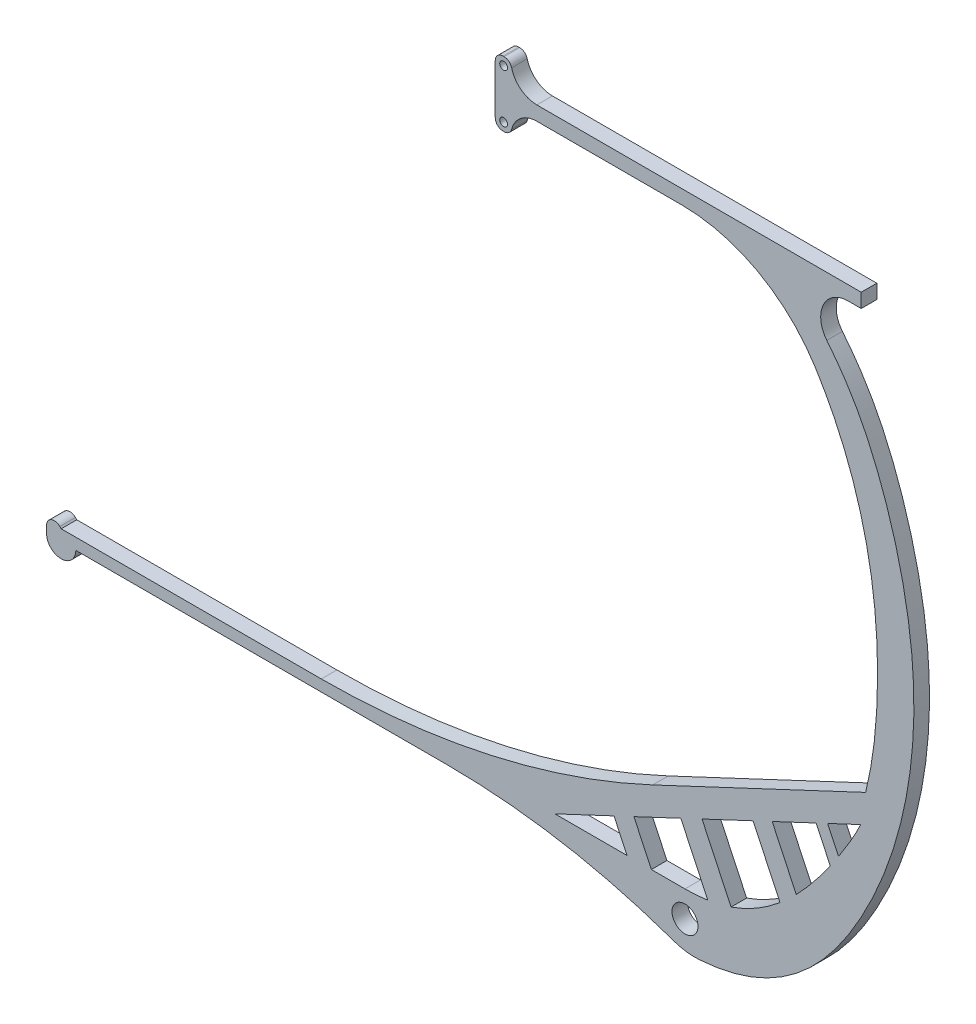
from build123d import *

# Parameters (mm, degrees)
BOSS_EXTRUDE1_DEPTH      = 3
BOSS_EXTRUDE1_DEPTH_BACK = 3
SKETCH1_R                = 5
FILLET1_START            = -3
FILLET1_DEPTH            = 6
SKETCH3_R                = 1.5
CUT_EXTRUDE1_DEPTH       = 349.413906295
FILLET2_R                = 3
BOSS_EXTRUDE2_DEPTH      = 6


with BuildPart() as part:
    # Sketch1 → Boss-Extrude1 (new, two sides: drawn at the far end of the back side and taken through both)
    with BuildSketch(Plane.XY.offset(-BOSS_EXTRUDE1_DEPTH_BACK)):
        with BuildLine():
            Line((-139.927663014, 10), (-240, 10))
            Line((-240, 10), (-240, 5.625896326))
            Line((-240, 5.625896326), (-91.67097898, 5.625896326))
            ThreePointArc((-91.67097898, 5.625896326), (-47.943457504, 1.922411841), (-5.461660623, -9.082535478))
            Line((-5.461660623, -9.082535478), (-4.403604208, -9.454396292))
            ThreePointArc((-4.403604208, -9.454396292), (0.528404036, -10.64278059), (5.598736393, -10.81216877))
            add(Edge.make_bspline(
                [(5.598736393, -10.81216877), (36.652992265, -8.693156062), (78.227632244, 36.40065328), (94.590344538, 116.465590815), (76.626831013, 184.736667386), (63.306328088, 209.262504208), (54.564036902, 220.049625577)],
                knots=[0.015792228, 0.015792228, 0.015792228, 0.015792228, 0.284946291, 0.62839983, 0.811916795, 0.93697406, 0.93697406, 0.93697406, 0.93697406], degree=3))
            ThreePointArc((54.564036902, 220.049625577), (53.234460191, 231.254741201), (62.776823889, 237.276840954))
            Line((62.776823889, 237.276840954), (67.80233028, 237.276840954))
            Line((67.80233028, 237.276840954), (67.80233028, 242.723159046))
            Line((67.80233028, 242.723159046), (-67, 242.723159046))
            Line((-67, 242.723159046), (-67, 252.5))
            Line((-67, 252.5), (-73, 252.5))
            Line((-73, 252.5), (-73, 227.5))
            Line((-73, 227.5), (-67, 227.5))
            Line((-67, 227.5), (-67, 237.276840954))
            Line((-67, 237.276840954), (-1.231721128, 237.276840954))
            ThreePointArc((-1.231721128, 237.276840954), (28.060310534, 229.72540467), (50.050624082, 208.953466413))
            add(Edge.make_bspline(
                [(69.500855603, 76.911874598), (72.264480227, 87.944058505), (76.527253704, 125.048471021), (70.268641745, 171.941971612), (53.737198263, 203.093850369), (50.050624082, 208.953466413)],
                knots=[0.407523856, 0.407523856, 0.407523856, 0.407523856, 0.537194929, 0.818083777, 0.885362915, 0.885362915, 0.885362915, 0.885362915], degree=3))
            Line((69.500855603, 76.911874598), (-12.418485843, 38.446304136))
            ThreePointArc((-12.418485843, 38.446304136), (-74.60580128, 17.197926272), (-139.927663014, 10))
        make_face()
        Polygon((-22.297907079, 10), (-50.037756473, 10), (-27.309138693, 20.672317834), align=None, mode=Mode.SUBTRACT)
        Circle(SKETCH1_R, mode=Mode.SUBTRACT)
        with BuildLine():
            Line((-12.943777745, 10), (-19.644842204, 24.271120406))
            Line((-19.644842204, 24.271120406), (-1.602641824, 32.742911289))
            Line((-1.602641824, 32.742911289), (8.776324123, 10.639039044))
            add(Edge.make_bspline(
                [(0, 10), (2.898943299, 10), (5.824093664, 10.191306611), (8.776324123, 10.639039044)],
                knots=[0, 0, 0, 0, 0.042648611, 0.042648611, 0.042648611, 0.042648611], degree=3))
            Line((0, 10), (-12.943777745, 10))
        make_face(mode=Mode.SUBTRACT)
        with BuildLine():
            Line((17.715361457, 12.81671237), (6.559363007, 36.5754149))
            Line((6.559363007, 36.5754149), (26.197910912, 45.79677746))
            Line((26.197910912, 45.79677746), (36.559125948, 23.730708969))
            add(Edge.make_bspline(
                [(17.715361457, 12.81671237), (23.876773005, 14.918250482), (30.155524994, 18.369562648), (36.559125948, 23.730708969)],
                knots=[0.085298322, 0.085298322, 0.085298322, 0.085298322, 0.172678594, 0.172678594, 0.172678594, 0.172678594], degree=3))
        make_face(mode=Mode.SUBTRACT)
        with BuildLine():
            Line((42.802893804, 29.541618599), (33.549359894, 49.248681172))
            Line((33.549359894, 49.248681172), (50.452093063, 57.185430446))
            Line((50.452093063, 57.185430446), (55.88081154, 45.623999347))
            add(Edge.make_bspline(
                [(42.802893804, 29.541618599), (44.494170175, 31.276751032), (48.877740455, 36.117777074), (53.319758571, 41.97043023), (55.88081154, 45.623999347)],
                knots=[0.2008995, 0.2008995, 0.2008995, 0.2008995, 0.223688019, 0.259663627, 0.259663627, 0.259663627, 0.259663627], degree=3))
        make_face(mode=Mode.SUBTRACT)
        with BuildLine():
            Line((59.074920902, 50.340281449), (54.883672726, 59.266297269))
            Line((54.883672726, 59.266297269), (67.59040472, 65.232796586))
            add(Edge.make_bspline(
                [(59.074920902, 50.340281449), (62.63241948, 55.77958039), (65.668587928, 61.082137876), (67.59040472, 65.232796586)],
                knots=[0.275095684, 0.275095684, 0.275095684, 0.275095684, 0.328599987, 0.328599987, 0.328599987, 0.328599987], degree=3))
        make_face(mode=Mode.SUBTRACT)
    extrude(amount=BOSS_EXTRUDE1_DEPTH + BOSS_EXTRUDE1_DEPTH_BACK)

    # Fillet1: read off the stored shape, not the designer's step
    # Fillet1 outline → Fillet1 (add)
    with BuildSketch(Plane.XY.offset(FILLET1_START)):
        with BuildLine():
            ThreePointArc((-57.002490308, 242.723159046), (-63.994214328, 245.573627926), (-67, 252.5))
            Line((-67, 252.5), (-67, 242.723159046))
            Line((-67, 242.723159046), (-57.002490308, 242.723159046))
        make_face()
        with BuildLine():
            ThreePointArc((-67, 227.5), (-63.994214328, 234.426372074), (-57.002490308, 237.276840954))
            Line((-57.002490308, 237.276840954), (-67, 237.276840954))
            Line((-67, 237.276840954), (-67, 227.5))
        make_face()
    extrude(amount=FILLET1_DEPTH)

    # Sketch3 → Cut-Extrude1 (cut, through all)
    with BuildSketch(Plane.XY.offset(3)):
        with Locations((-69.784641705, 249.396863572)):
            Circle(SKETCH3_R)
        with Locations((-69.784641705, 230.603136428)):
            Circle(SKETCH3_R)
    extrude(amount=-CUT_EXTRUDE1_DEPTH, mode=Mode.SUBTRACT)

    # Fillet2
    fillet2_edges = [part.edges().sort_by_distance(p)[0] for p in [
        (-67, 227.5, 0),
        (-73, 227.5, 0),
        (-73, 252.5, 0),
        (-67, 252.5, 0),
    ]]
    fillet(fillet2_edges, radius=FILLET2_R)

    # Sketch4 → Boss-Extrude2 (add)
    with BuildSketch(Plane.XY.offset(3)):
        with BuildLine():
            Line((-245.625896326, 5.625896326), (-245.625896326, 8.383255638))
            ThreePointArc((-245.625896326, 8.383255638), (-243.773946623, 11.154894236), (-240.504575982, 10.504575982))
            Line((-240.504575982, 10.504575982), (-240, 10))
            Line((-240, 10), (-240, 6.942968022))
            Line((-240, 6.942968022), (-240, 5.625896326))
            Line((-240, 5.625896326), (-234.374103674, 5.625896326))
            ThreePointArc((-234.374103674, 5.625896326), (-240, 0), (-245.625896326, 5.625896326))
        make_face()
    extrude(amount=-BOSS_EXTRUDE2_DEPTH)


solid = part.part
